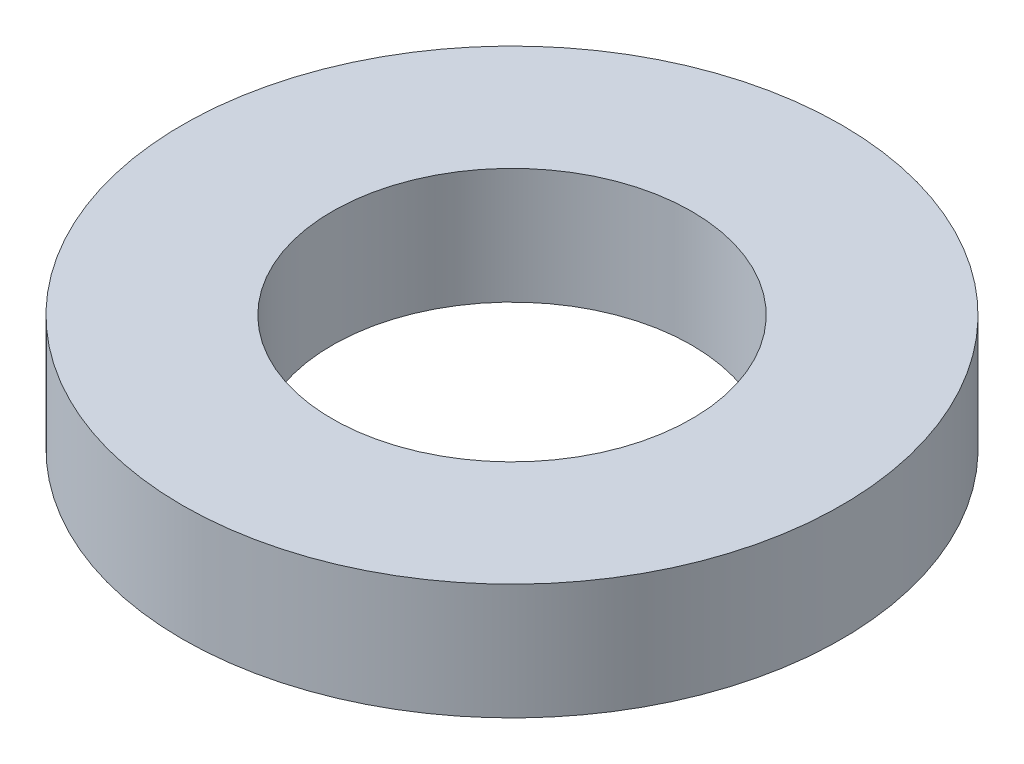
from build123d import *

# Parameters (mm, degrees)
SKETCH1_R           = 82.5
BOSS_EXTRUDE1_DEPTH = 29
SKETCH2_R           = 45
CUT_EXTRUDE1_DEPTH  = 121.222710001


with BuildPart() as part:
    # Sketch1 → Boss-Extrude1 (new body)
    with BuildSketch(Plane(origin=(0, 0, 0), x_dir=(1, 0, 0), z_dir=(0, 1, 0))):
        Circle(SKETCH1_R)
    extrude(amount=BOSS_EXTRUDE1_DEPTH)

    # Sketch2 → Cut-Extrude1 (cut, through all)
    with BuildSketch(Plane(origin=(0, 0, 0), x_dir=(1, 0, 0), z_dir=(0, 1, 0))):
        Circle(SKETCH2_R)
    extrude(amount=CUT_EXTRUDE1_DEPTH, mode=Mode.SUBTRACT)


solid = part.part
